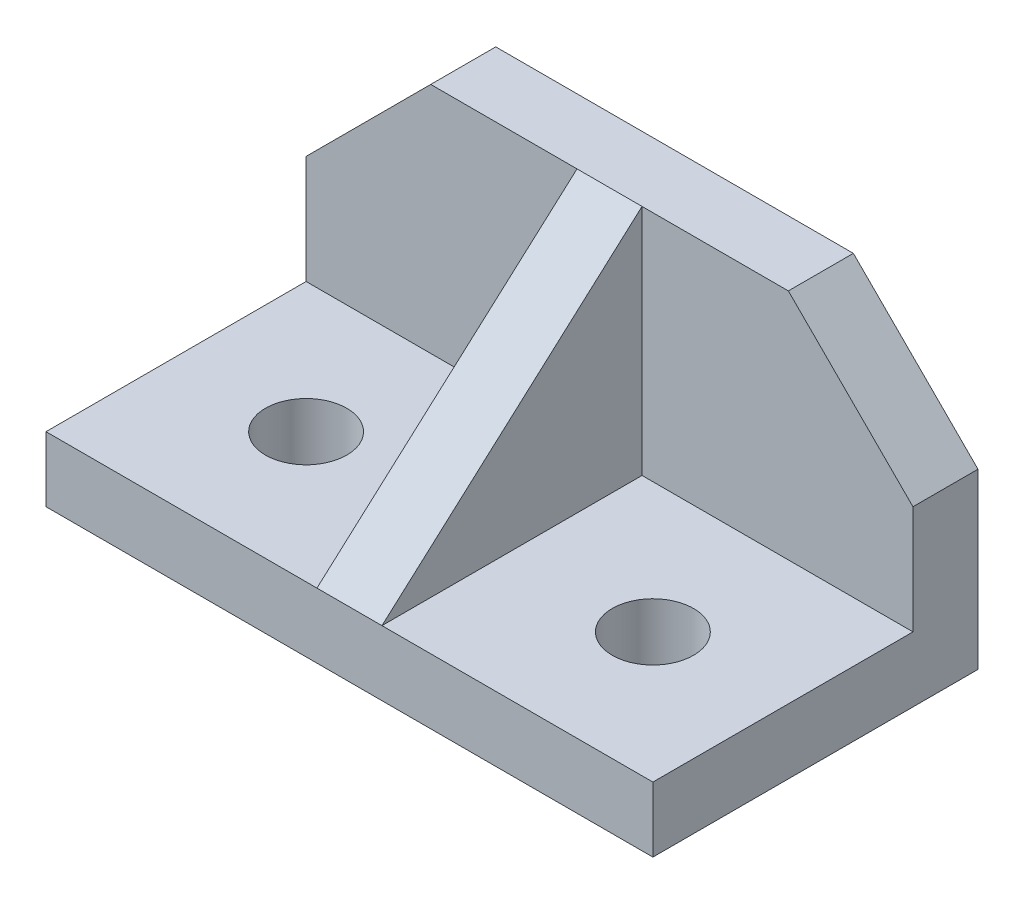
from build123d import *

# Parameters (mm, degrees)
SKETCH14_W              = 112
SKETCH14_H              = 48
SKETCH14_R              = 7.5
BOSS_EXTRUDE10_DEPTH    = 12
BOSS_EXTRUDE12_DEPTH    = 12
SKETCH24_W              = 12
SKETCH24_H              = 43
BOSS_EXTRUDE13_DEPTH    = 48
CUT_EXTRUDE1_DEPTH      = 96.775779819
CUT_EXTRUDE1_DEPTH_BACK = 48


with BuildPart() as part:
    # Sketch14 → Boss-Extrude10 (new body)
    with BuildSketch(Plane(origin=(0, 0, 0), x_dir=(1, 0, 0), z_dir=(0, 1, 0))):
        with Locations((56, -24)):
            Rectangle(SKETCH14_W, SKETCH14_H)
        with Locations((88, -24)):
            Circle(SKETCH14_R, mode=Mode.SUBTRACT)
        with Locations((24, -24)):
            Circle(SKETCH14_R, mode=Mode.SUBTRACT)
    extrude(amount=BOSS_EXTRUDE10_DEPTH)

    # Sketch20 → Boss-Extrude12 (add)
    with BuildSketch(Plane.XY):
        Polygon((23, 55), (0, 32), (0, 0), (112, 0), (112, 32), (89, 55), align=None)
    extrude(amount=-BOSS_EXTRUDE12_DEPTH)

    # Sketch24 → Boss-Extrude13 (add)
    with BuildSketch(Plane.XY):
        with Locations((56, 33.5)):
            Rectangle(SKETCH24_W, SKETCH24_H)
    extrude(amount=BOSS_EXTRUDE13_DEPTH)

    # Sketch25 → Cut-Extrude1 (cut, two sides: drawn at the far end of the back side and taken through both)
    with BuildSketch(Plane.ZY.offset(-50).offset(-CUT_EXTRUDE1_DEPTH_BACK)):
        Polygon((-117.411882981, 160.181478504), (0, 55), (48, 12), (165.411882981, -93.181478504), (375.774839989, 141.642287458), (92.951074027, 395.005244466), align=None)
    extrude(amount=CUT_EXTRUDE1_DEPTH + CUT_EXTRUDE1_DEPTH_BACK, mode=Mode.SUBTRACT)


solid = part.part
